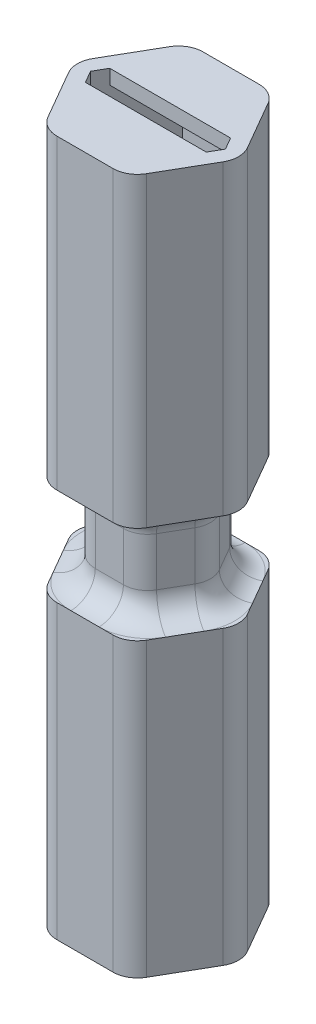
from build123d import *

# Parameters (mm, degrees)
BOSS_EXTRUDE1_DEPTH  = 10
BOSS_EXTRUDE2_DEPTH  = 5
BOSS_EXTRUDE3_DEPTH  = 60
FILLET1_R            = 5
FILLET1_OF_MIRROR1_R = 5
BOSS_EXTRUDE4_DEPTH  = 3
FILLET2_R            = 5


with BuildPart() as part:
    # Sketch1 → Boss-Extrude1 (new body)
    with BuildSketch(Plane(origin=(0, 0, 0), x_dir=(1, 0, 0), z_dir=(0, 1, 0))):
        Polygon((-5.773502692, -10), (5.773502692, -10), (11.547005384, 0), (5.773502692, 10), (-5.773502692, 10), (-11.547005384, 0), align=None)
        Polygon((-4.041451884, -7), (4.041451884, -7), (8.082903769, 0), (4.041451884, 7), (-4.041451884, 7), (-8.082903769, 0), align=None, mode=Mode.SUBTRACT)
    boss_extrude1 = extrude(amount=BOSS_EXTRUDE1_DEPTH)

    # Sketch1<3> → Boss-Extrude2 (add)
    # profile 1 of 2: a face of its own
    with BuildSketch(Plane(origin=(0, 0, 0), x_dir=(1, 0, 0), z_dir=(0, 1, 0))):
        Polygon((-6.92820323, -12), (6.92820323, -12), (13.856406461, 0), (6.92820323, 12), (-6.92820323, 12), (-13.856406461, 0), align=None)
        Polygon((5.773502692, -10), (11.547005384, 0), (5.773502692, 10), (-5.773502692, 10), (-11.547005384, 0), (-5.773502692, -10), align=None, mode=Mode.SUBTRACT)
    # profile 2 of 2: a face of its own
    with BuildSketch(Plane(origin=(0, 0, 0), x_dir=(1, 0, 0), z_dir=(0, 1, 0))):
        Polygon((-5.773502692, -10), (5.773502692, -10), (11.547005384, 0), (5.773502692, 10), (-5.773502692, 10), (-11.547005384, 0), align=None)
        Polygon((-4.041451884, -7), (4.041451884, -7), (8.082903769, 0), (4.041451884, 7), (-4.041451884, 7), (-8.082903769, 0), align=None, mode=Mode.SUBTRACT)
    boss_extrude2 = extrude(amount=-BOSS_EXTRUDE2_DEPTH)

    # Sketch1<4> → Boss-Extrude3 (add)
    with BuildSketch(Plane(origin=(0, 0, 0), x_dir=(1, 0, 0), z_dir=(0, 1, 0))):
        Polygon((-8.660254038, -15), (8.660254038, -15), (17.320508076, 0), (8.660254038, 15), (-8.660254038, 15), (-17.320508076, 0), align=None)
        Polygon((6.92820323, -12), (13.856406461, 0), (6.92820323, 12), (-6.92820323, 12), (-13.856406461, 0), (-6.92820323, -12), align=None, mode=Mode.SUBTRACT)
    boss_extrude3 = extrude(amount=-BOSS_EXTRUDE3_DEPTH)

    # Fillet1
    fillet1_edges = [part.edges().sort_by_distance(p)[0] for p in [
        (8.660254038, -30, 15),
        (-8.660254038, -30, 15),
        (-17.320508076, -30, 0),
        (-8.660254038, -30, -15),
        (8.660254038, -30, -15),
        (17.320508076, -30, 0),
    ]]
    fillet(fillet1_edges, radius=FILLET1_R)

    # Mirror1: Boss-Extrude1, Boss-Extrude2, Boss-Extrude3 across plane
    add(boss_extrude1.mirror(Plane.ZX.offset(10)))
    add(boss_extrude2.mirror(Plane.ZX.offset(10)))
    add(boss_extrude3.mirror(Plane.ZX.offset(10)))

    # Fillet1 of Mirror1
    fillet1_of_mirror1_edges = [part.edges().sort_by_distance(p)[0] for p in [
        (8.660254038, 50, 15),
        (-8.660254038, 50, 15),
        (-17.320508076, 50, 0),
        (-8.660254038, 50, -15),
        (8.660254038, 50, -15),
        (17.320508076, 50, 0),
    ]]
    fillet(fillet1_of_mirror1_edges, radius=FILLET1_OF_MIRROR1_R)

    # Sketch2 → Boss-Extrude4 (add)
    # profile 1 of 6: a face of its own
    with BuildSketch(Plane(origin=(0, 80, 0), x_dir=(1, 0, 0), z_dir=(0, 1, 0))):
        with BuildLine():
            ThreePointArc((10.103629711, 12.5), (8.273502692, 14.330127019), (5.773502692, 15))
            Line((5.773502692, 15), (-5.773502692, 15))
            ThreePointArc((-5.773502692, 15), (-8.273502692, 14.330127019), (-10.103629711, 12.5))
            Line((-10.103629711, 12.5), (-15.877132403, 2.5))
            ThreePointArc((-15.877132403, 2.5), (-16.547005384, 0), (-15.877132403, -2.5))
            Line((-15.877132403, -2.5), (-10.103629711, -12.5))
            ThreePointArc((-10.103629711, -12.5), (-8.273502692, -14.330127019), (-5.773502692, -15))
            Line((-5.773502692, -15), (5.773502692, -15))
            ThreePointArc((5.773502692, -15), (8.273502692, -14.330127019), (10.103629711, -12.5))
            Line((10.103629711, -12.5), (15.877132403, -2.5))
            ThreePointArc((15.877132403, -2.5), (16.547005384, 0), (15.877132403, 2.5))
            Line((15.877132403, 2.5), (10.103629711, 12.5))
        make_face()
        Polygon((6.92820323, 12), (13.856406461, 0), (6.92820323, -12), (-6.92820323, -12), (-13.856406461, 0), (-6.92820323, 12), align=None, mode=Mode.SUBTRACT)
    # profile 2 of 6: a face of its own
    with BuildSketch(Plane(origin=(0, 80, 0), x_dir=(1, 0, 0), z_dir=(0, 1, 0))):
        Polygon((-6.92820323, 12), (-12.413030788, 2.5), (12.413030788, 2.5), (6.92820323, 12), align=None)
    # profile 3 of 6: a face of its own
    with BuildSketch(Plane(origin=(0, 80, 0), x_dir=(1, 0, 0), z_dir=(0, 1, 0))):
        Polygon((12.413030788, -2.5), (-12.413030788, -2.5), (-6.92820323, -12), (6.92820323, -12), align=None)
    # profile 4 of 6: a face of its own
    with BuildSketch(Plane(origin=(0, 80, 0), x_dir=(1, 0, 0), z_dir=(0, 1, 0))):
        with BuildLine():
            Line((-12.413030788, -2.5), (-15.877132403, -2.5))
            Line((-15.877132403, -2.5), (-10.103629711, -12.5))
            ThreePointArc((-10.103629711, -12.5), (-8.273502692, -14.330127019), (-5.773502692, -15))
            Line((-5.773502692, -15), (5.773502692, -15))
            ThreePointArc((5.773502692, -15), (8.273502692, -14.330127019), (10.103629711, -12.5))
            Line((10.103629711, -12.5), (15.877132403, -2.5))
            Line((15.877132403, -2.5), (12.413030788, -2.5))
            Line((12.413030788, -2.5), (6.92820323, -12))
            Line((6.92820323, -12), (-6.92820323, -12))
            Line((-6.92820323, -12), (-12.413030788, -2.5))
        make_face()
    # profile 5 of 6: a face of its own
    with BuildSketch(Plane(origin=(0, 80, 0), x_dir=(1, 0, 0), z_dir=(0, 1, 0))):
        with BuildLine():
            Line((15.877132403, 2.5), (12.413030788, 2.5))
            Line((12.413030788, 2.5), (13.856406461, 0))
            Line((13.856406461, 0), (12.413030788, -2.5))
            Line((12.413030788, -2.5), (15.877132403, -2.5))
            ThreePointArc((15.877132403, -2.5), (16.547005384, 0), (15.877132403, 2.5))
        make_face()
    # profile 6 of 6: a face of its own
    with BuildSketch(Plane(origin=(0, 80, 0), x_dir=(1, 0, 0), z_dir=(0, 1, 0))):
        with BuildLine():
            Line((-12.413030788, 2.5), (-15.877132403, 2.5))
            ThreePointArc((-15.877132403, 2.5), (-16.547005384, 0), (-15.877132403, -2.5))
            Line((-15.877132403, -2.5), (-12.413030788, -2.5))
            Line((-12.413030788, -2.5), (-13.856406461, 0))
            Line((-13.856406461, 0), (-12.413030788, 2.5))
        make_face()
    extrude(amount=BOSS_EXTRUDE4_DEPTH)

    # Fillet2
    fillet2_edges = [part.edges().sort_by_distance(p)[0] for p in [
        (-8.660254038, 0, 5),
        (-8.660254038, 0, -5),
        (0, 0, -10),
        (8.660254038, 0, -5),
        (0, 20, 10),
        (8.660254038, 20, 5),
        (8.660254038, 20, -5),
        (0, 20, -10),
        (-8.660254038, 20, -5),
        (-8.660254038, 20, 5),
        (8.660254038, 0, 5),
        (0, 0, 10),
        (-5.773502692, 10, 10),
        (-11.547005384, 10, 0),
        (-5.773502692, 10, -10),
        (5.773502692, 10, -10),
        (11.547005384, 10, 0),
        (5.773502692, 10, 10),
    ]]
    fillet(fillet2_edges, radius=FILLET2_R - 0.0001)  # a hair under: the kernel refuses the full size


solid = part.part
